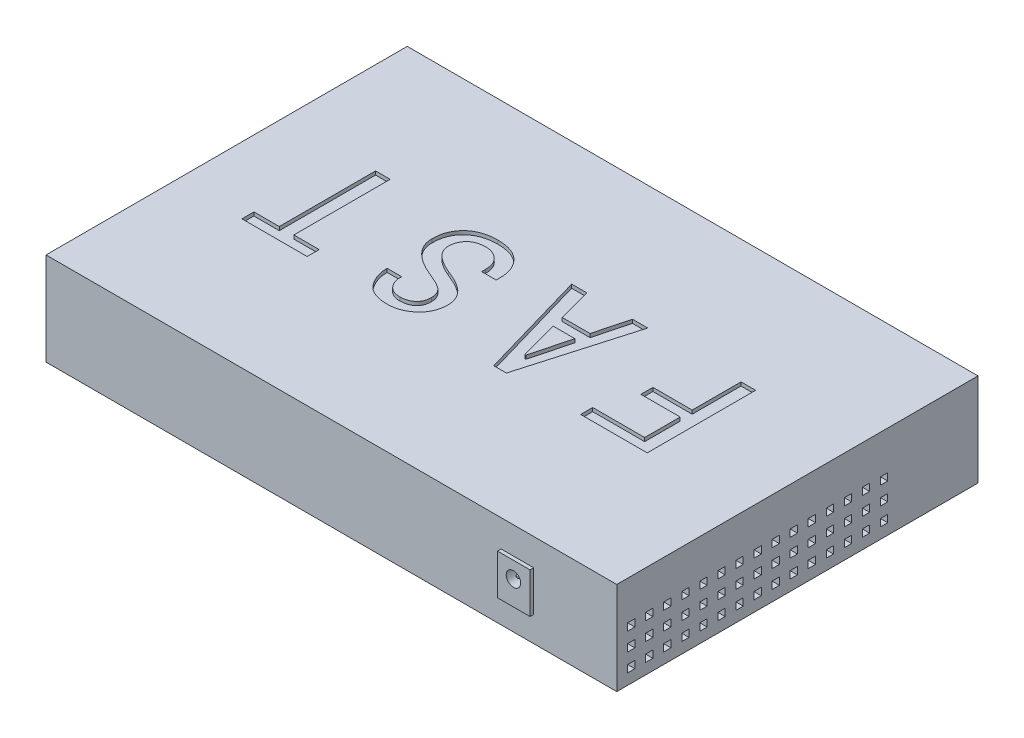
from build123d import *

# Parameters (mm, degrees)
SKETCH_1_W                     = 158
SKETCH_1_H                     = 100
EXTRUDE_1_DEPTH                = 25.7
CUT_EXTRUDE_1_DEPTH            = 11
PATTERN_LINEAR_1_COUNT         = 8
PATTERN_LINEAR_1_PITCH         = 14.7
SKETCH_3_W                     = 120
SKETCH_3_H                     = 15.5
SKETCH_3_W_2                   = 118
SKETCH_3_H_2                   = 13.5
CUT_EXTRUDE_2_DEPTH            = 13
CUT_EXTRUDE_3_DEPTH            = 1
SKETCH_5_R                     = 2
SKETCH_5_R_2                   = 0.5
CUT_EXTRUDE_4_DEPTH            = 8
FILLET_1_R                     = 0.4
EXTRUDE_START                  = 1
SKETCH_6_W                     = 9
SKETCH_6_H                     = 11.2
SKETCH_6_R                     = 2
EXTRUDE_2_DEPTH                = 1
SKETCH_7_W                     = 2
SKETCH_7_H                     = 2
CUT_EXTRUDE_5_DEPTH            = 10
PATTERN_LINEAR_2_COUNT         = 15
PATTERN_LINEAR_2_PITCH         = 5
PATTERN_LINEAR_2_COUNT_DIR2    = 3
PATTERN_LINEAR_2_PITCH_DIR2    = 5
MIRROR_1_COPY_1_SKETCH_W       = 2
MIRROR_1_COPY_1_SKETCH_H       = 2
MIRROR_1_COPY_1_DEPTH          = 10
MIRROR_1_COPY_2_SKETCH_W       = 2
MIRROR_1_COPY_2_SKETCH_H       = 2
MIRROR_1_COPY_2_DEPTH          = 10
MIRROR_1_COPY_3_SKETCH_W       = 2
MIRROR_1_COPY_3_SKETCH_H       = 2
MIRROR_1_COPY_3_DEPTH          = 10
MIRROR_1_COPY_4_SKETCH_W       = 2
MIRROR_1_COPY_4_SKETCH_H       = 2
MIRROR_1_COPY_4_DEPTH          = 10
MIRROR_1_COPY_5_SKETCH_W       = 2
MIRROR_1_COPY_5_SKETCH_H       = 2
MIRROR_1_COPY_5_DEPTH          = 10
MIRROR_1_COPY_6_SKETCH_W       = 2
MIRROR_1_COPY_6_SKETCH_H       = 2
MIRROR_1_COPY_6_DEPTH          = 10
MIRROR_1_COPY_7_SKETCH_W       = 2
MIRROR_1_COPY_7_SKETCH_H       = 2
MIRROR_1_COPY_7_DEPTH          = 10
MIRROR_1_COPY_8_SKETCH_W       = 2
MIRROR_1_COPY_8_SKETCH_H       = 2
MIRROR_1_COPY_8_DEPTH          = 10
MIRROR_1_COPY_9_SKETCH_W       = 2
MIRROR_1_COPY_9_SKETCH_H       = 2
MIRROR_1_COPY_9_DEPTH          = 10
MIRROR_1_COPY_10_SKETCH_W      = 2
MIRROR_1_COPY_10_SKETCH_H      = 2
MIRROR_1_COPY_10_DEPTH         = 10
MIRROR_1_COPY_11_SKETCH_W      = 2
MIRROR_1_COPY_11_SKETCH_H      = 2
MIRROR_1_COPY_11_DEPTH         = 10
MIRROR_1_COPY_12_SKETCH_W      = 2
MIRROR_1_COPY_12_SKETCH_H      = 2
MIRROR_1_COPY_12_DEPTH         = 10
MIRROR_1_COPY_13_SKETCH_W      = 2
MIRROR_1_COPY_13_SKETCH_H      = 2
MIRROR_1_COPY_13_DEPTH         = 10
MIRROR_1_COPY_14_SKETCH_W      = 2
MIRROR_1_COPY_14_SKETCH_H      = 2
MIRROR_1_COPY_14_DEPTH         = 10
MIRROR_1_COPY_15_SKETCH_W      = 2
MIRROR_1_COPY_15_SKETCH_H      = 2
MIRROR_1_COPY_15_DEPTH         = 10
MIRROR_1_COPY_16_SKETCH_W      = 2
MIRROR_1_COPY_16_SKETCH_H      = 2
MIRROR_1_COPY_16_DEPTH         = 10
MIRROR_1_COPY_17_SKETCH_W      = 2
MIRROR_1_COPY_17_SKETCH_H      = 2
MIRROR_1_COPY_17_DEPTH         = 10
MIRROR_1_COPY_18_SKETCH_W      = 2
MIRROR_1_COPY_18_SKETCH_H      = 2
MIRROR_1_COPY_18_DEPTH         = 10
MIRROR_1_COPY_19_SKETCH_W      = 2
MIRROR_1_COPY_19_SKETCH_H      = 2
MIRROR_1_COPY_19_DEPTH         = 10
MIRROR_1_COPY_20_SKETCH_W      = 2
MIRROR_1_COPY_20_SKETCH_H      = 2
MIRROR_1_COPY_20_DEPTH         = 10
MIRROR_1_COPY_21_SKETCH_W      = 2
MIRROR_1_COPY_21_SKETCH_H      = 2
MIRROR_1_COPY_21_DEPTH         = 10
MIRROR_1_COPY_22_SKETCH_W      = 2
MIRROR_1_COPY_22_SKETCH_H      = 2
MIRROR_1_COPY_22_DEPTH         = 10
MIRROR_1_COPY_23_SKETCH_W      = 2
MIRROR_1_COPY_23_SKETCH_H      = 2
MIRROR_1_COPY_23_DEPTH         = 10
MIRROR_1_COPY_24_SKETCH_W      = 2
MIRROR_1_COPY_24_SKETCH_H      = 2
MIRROR_1_COPY_24_DEPTH         = 10
MIRROR_1_COPY_25_SKETCH_W      = 2
MIRROR_1_COPY_25_SKETCH_H      = 2
MIRROR_1_COPY_25_DEPTH         = 10
MIRROR_1_COPY_26_SKETCH_W      = 2
MIRROR_1_COPY_26_SKETCH_H      = 2
MIRROR_1_COPY_26_DEPTH         = 10
MIRROR_1_COPY_27_SKETCH_W      = 2
MIRROR_1_COPY_27_SKETCH_H      = 2
MIRROR_1_COPY_27_DEPTH         = 10
MIRROR_1_COPY_28_SKETCH_W      = 2
MIRROR_1_COPY_28_SKETCH_H      = 2
MIRROR_1_COPY_28_DEPTH         = 10
MIRROR_1_COPY_29_SKETCH_W      = 2
MIRROR_1_COPY_29_SKETCH_H      = 2
MIRROR_1_COPY_29_DEPTH         = 10
MIRROR_1_COPY_30_SKETCH_W      = 2
MIRROR_1_COPY_30_SKETCH_H      = 2
MIRROR_1_COPY_30_DEPTH         = 10
MIRROR_1_COPY_31_SKETCH_W      = 2
MIRROR_1_COPY_31_SKETCH_H      = 2
MIRROR_1_COPY_31_DEPTH         = 10
MIRROR_1_COPY_32_SKETCH_W      = 2
MIRROR_1_COPY_32_SKETCH_H      = 2
MIRROR_1_COPY_32_DEPTH         = 10
MIRROR_1_COPY_33_SKETCH_W      = 2
MIRROR_1_COPY_33_SKETCH_H      = 2
MIRROR_1_COPY_33_DEPTH         = 10
MIRROR_1_COPY_34_SKETCH_W      = 2
MIRROR_1_COPY_34_SKETCH_H      = 2
MIRROR_1_COPY_34_DEPTH         = 10
MIRROR_1_COPY_35_SKETCH_W      = 2
MIRROR_1_COPY_35_SKETCH_H      = 2
MIRROR_1_COPY_35_DEPTH         = 10
MIRROR_1_COPY_36_SKETCH_W      = 2
MIRROR_1_COPY_36_SKETCH_H      = 2
MIRROR_1_COPY_36_DEPTH         = 10
MIRROR_1_COPY_37_SKETCH_W      = 2
MIRROR_1_COPY_37_SKETCH_H      = 2
MIRROR_1_COPY_37_DEPTH         = 10
MIRROR_1_COPY_38_SKETCH_W      = 2
MIRROR_1_COPY_38_SKETCH_H      = 2
MIRROR_1_COPY_38_DEPTH         = 10
MIRROR_1_COPY_39_SKETCH_W      = 2
MIRROR_1_COPY_39_SKETCH_H      = 2
MIRROR_1_COPY_39_DEPTH         = 10
MIRROR_1_COPY_40_SKETCH_W      = 2
MIRROR_1_COPY_40_SKETCH_H      = 2
MIRROR_1_COPY_40_DEPTH         = 10
MIRROR_1_COPY_41_SKETCH_W      = 2
MIRROR_1_COPY_41_SKETCH_H      = 2
MIRROR_1_COPY_41_DEPTH         = 10
MIRROR_1_COPY_42_SKETCH_W      = 2
MIRROR_1_COPY_42_SKETCH_H      = 2
MIRROR_1_COPY_42_DEPTH         = 10
MIRROR_1_COPY_43_SKETCH_W      = 2
MIRROR_1_COPY_43_SKETCH_H      = 2
MIRROR_1_COPY_43_DEPTH         = 10
MIRROR_1_COPY_44_SKETCH_W      = 2
MIRROR_1_COPY_44_SKETCH_H      = 2
MIRROR_1_COPY_44_DEPTH         = 10
SKETCH_8_W                     = 6
SKETCH_8_H                     = 4
CUT_EXTRUDE_6_DEPTH            = 5
SKETCH_9_W                     = 2
SKETCH_9_H                     = 3
EXTRUDE_3_DEPTH                = 5
SKETCH_10_R                    = 1.1
SKETCH_10_R_2                  = 1
CUT_EXTRUDE_7_DEPTH            = 1
FILLET_2_R                     = 1
PATTERN_LINEAR_4_COUNT         = 2
PATTERN_LINEAR_4_PITCH         = 5
FILLET_2_OF_PATTERN_LINEAR_4_R = 1


with BuildPart() as part:
    # 草图1 → 凸台-拉伸1 (new body)
    with BuildSketch(Plane(origin=(0, 0, 0), x_dir=(1, 0, 0), z_dir=(0, 1, 0))):
        Rectangle(SKETCH_1_W, SKETCH_1_H)
    extrude(amount=EXTRUDE_1_DEPTH)

    # 草图2 → 切除-拉伸1 (cut)
    with BuildSketch(Plane(origin=(0, 0, -50), x_dir=(-1, 0, 0), z_dir=(0, 0, -1))):
        Polygon((-44.7, 9.4), (-56.7, 9.4), (-56.7, 16.4), (-53.8, 16.4), (-53.8, 17.9), (-52.75, 17.9), (-52.75, 19.4), (-48.65, 19.4), (-48.65, 17.9), (-47.6, 17.9), (-47.6, 16.4), (-44.7, 16.4), align=None)
    cut_extrude_1 = extrude(amount=-CUT_EXTRUDE_1_DEPTH, mode=Mode.SUBTRACT)

    # 阵列(线性)1: 切除-拉伸1 ×8
    with Locations(*[(-i * PATTERN_LINEAR_1_PITCH, 0, 0) for i in range(1, PATTERN_LINEAR_1_COUNT)]):
        add(cut_extrude_1, mode=Mode.SUBTRACT)

    # 草图3 → 切除-拉伸2 (cut)
    with BuildSketch(Plane(origin=(0, 0, -50), x_dir=(-1, 0, 0), z_dir=(0, 0, -1))):
        with Locations((0, 13.95)):
            Rectangle(SKETCH_3_W, SKETCH_3_H)
        with Locations((0, 13.95)):
            Rectangle(SKETCH_3_W_2, SKETCH_3_H_2, mode=Mode.SUBTRACT)
    extrude(amount=-CUT_EXTRUDE_2_DEPTH, mode=Mode.SUBTRACT)

    # 草图4 → 切除-拉伸3 (cut)
    # profile 1 of 4: a face of its own
    with BuildSketch(Plane(origin=(0, 25.7, 0), x_dir=(1, 0, 0), z_dir=(0, 1, 0))):
        Polygon((-60.538684768, -10.903965786), (-53.521140909, -10.903965786), (-53.521140909, 15.762700881), (-49.486053189, 15.762700881), (-49.486053189, -10.903965786), (-42.46850933, -10.903965786), (-42.46850933, -14.237299119), (-60.538684768, -14.237299119), align=None)
    # profile 2 of 4: a face of its own
    with BuildSketch(Plane(origin=(0, 25.7, 0), x_dir=(1, 0, 0), z_dir=(0, 1, 0))):
        with BuildLine():
            add(Edge.make_bspline(
                [(-29.45096547, 7.341648249), (-29.443750655, 7.669045713), (-29.42965478, 8.308695296), (-29.311429656, 9.244722705), (-29.111451558, 10.128478376), (-28.830816099, 10.960497752), (-28.472227092, 11.738767941), (-28.033945629, 12.464173796), (-27.517874369, 13.140150689), (-26.917249359, 13.753008988), (-26.257211854, 14.316321199), (-25.526009929, 14.796102086), (-24.73764707, 15.199832312), (-23.897873054, 15.540946388), (-22.998003641, 15.799123872), (-22.04075881, 15.979228981), (-21.028223701, 16.090977755), (-20.332784428, 16.105933045), (-19.97728126, 16.113578074)],
                knots=[0, 0, 0, 0, 1.076152623, 2.102522632, 3.095849728, 4.050677474, 4.984236423, 5.907526567, 6.831914559, 7.773667167, 8.723756284, 9.679698709, 10.641564268, 11.632028302, 12.655206477, 13.713851791, 14.831338746, 16, 16, 16, 16], degree=3))
            add(Edge.make_bspline(
                [(-19.97728126, 16.113578074), (-19.621718476, 16.106603863), (-18.928073296, 16.092998313), (-17.919951909, 15.972609753), (-16.969304367, 15.785827901), (-16.076350171, 15.52331859), (-15.247992653, 15.169827998), (-14.481742913, 14.74195787), (-13.765120761, 14.251516669), (-13.129672402, 13.66743873), (-12.54700089, 13.043319187), (-12.055454937, 12.361129396), (-11.628781235, 11.649352281), (-11.27408703, 10.900615469), (-11.007908336, 10.10818018), (-10.82216562, 9.278250188), (-10.699904752, 8.410885227), (-10.686074938, 7.818571185), (-10.679035646, 7.517086845)],
                knots=[0, 0, 0, 0, 1.196431777, 2.334043873, 3.412092395, 4.454650557, 5.460757451, 6.436532977, 7.405283824, 8.375816144, 9.335554645, 10.274635542, 11.199860808, 12.126090833, 13.057499603, 14.007217359, 14.985685436, 16, 16, 16, 16], degree=3))
            Line((-10.679035646, 7.517086845), (-10.679035646, 6.28901667))
            Line((-10.679035646, 6.28901667), (-14.714123365, 6.28901667))
            Line((-14.714123365, 6.28901667), (-14.714123365, 7.341648249))
            add(Edge.make_bspline(
                [(-14.714123365, 7.341648249), (-14.719553908, 7.554082), (-14.730169531, 7.969347427), (-14.799750403, 8.572448076), (-14.924024286, 9.138491055), (-15.098297559, 9.663390597), (-15.321351935, 10.152419065), (-15.595397418, 10.60051656), (-15.914937209, 11.015652353), (-16.408439808, 11.501151711), (-17.088899768, 12.013502745), (-17.992938732, 12.456724468), (-18.962081614, 12.737602055), (-19.635316612, 12.765880776), (-19.97728126, 12.78024474)],
                knots=[0, 0, 0, 0, 0.89970853, 1.758749939, 2.566656616, 3.349866332, 4.096893782, 4.837870496, 5.569993442, 6.309435511, 7.764284211, 9.154994143, 10.554900695, 12, 12, 12, 12], degree=3))
            add(Edge.make_bspline(
                [(-19.97728126, 12.78024474), (-20.202635285, 12.774191525), (-20.641287115, 12.762408935), (-21.277028152, 12.702173773), (-21.865789736, 12.582924397), (-22.410140801, 12.42384673), (-22.903175594, 12.207795572), (-23.354405499, 11.952011975), (-23.75841661, 11.647939641), (-24.219578503, 11.179100003), (-24.700369691, 10.524849709), (-25.112201041, 9.64840775), (-25.369829881, 8.694619921), (-25.400275595, 8.032059804), (-25.415877751, 7.692525442)],
                knots=[0, 0, 0, 0, 0.962256228, 1.873032692, 2.721618148, 3.523059968, 4.28910919, 5.013874417, 5.733193765, 6.439259544, 7.815088487, 9.175735836, 10.552682683, 12, 12, 12, 12], degree=3))
            add(Edge.make_bspline(
                [(-25.415877751, 7.692525442), (-25.410508486, 7.547109527), (-25.399865558, 7.258866912), (-25.325208071, 6.829243729), (-25.203614467, 6.407388039), (-25.022849797, 5.996272761), (-24.804340071, 5.59016833), (-24.52344785, 5.20051806), (-24.208752335, 4.808088534), (-23.696419923, 4.295233848), (-22.939877411, 3.67401439), (-21.878166781, 2.981843958), (-20.645210805, 2.317779786), (-19.746689303, 1.93062667), (-19.275526874, 1.727613161)],
                knots=[0, 0, 0, 0, 0.578138014, 1.145981947, 1.729294273, 2.319686506, 2.928759201, 3.559612696, 4.226874004, 4.927334085, 6.438251822, 8.110552943, 9.960470262, 12, 12, 12, 12], degree=3))
            add(Edge.make_bspline(
                [(-19.275526874, 1.727613161), (-18.936814324, 1.595403281), (-18.279110594, 1.338681375), (-17.334593564, 0.930443959), (-16.466362537, 0.50801221), (-15.667060465, 0.083779253), (-14.952963359, -0.37085276), (-14.299936359, -0.819514414), (-13.727181499, -1.287865282), (-13.225967469, -1.768645738), (-12.787214229, -2.261300416), (-12.414052589, -2.78148048), (-12.094332831, -3.31977139), (-11.833410379, -3.881405678), (-11.62869673, -4.464348155), (-11.490163816, -5.070606257), (-11.391304547, -5.698233022), (-11.384331012, -6.125571061), (-11.380790031, -6.342562277)],
                knots=[0, 0, 0, 0, 1.44289125, 2.801770879, 4.081899673, 5.274145028, 6.390249298, 7.439444364, 8.416746341, 9.322525631, 10.193374079, 11.030703231, 11.859162121, 12.674406529, 13.484468958, 14.305897585, 15.139778559, 16, 16, 16, 16], degree=3))
            add(Edge.make_bspline(
                [(-11.380790031, -6.342562277), (-11.388171875, -6.641812434), (-11.402673232, -7.229678265), (-11.519893054, -8.090495027), (-11.722377493, -8.906667038), (-12.001882492, -9.678609271), (-12.363564018, -10.405198997), (-12.799164135, -11.09264481), (-13.323642739, -11.730728457), (-13.919103953, -12.317110621), (-14.567521494, -12.846509933), (-15.247214535, -13.316605838), (-15.96169019, -13.709913393), (-16.707304728, -14.027369527), (-17.479626464, -14.285210566), (-18.286501464, -14.455515638), (-19.120388423, -14.57404352), (-19.688781821, -14.583418071), (-19.97728126, -14.588176312)],
                knots=[0, 0, 0, 0, 1.0788326, 2.119326615, 3.125182374, 4.106076261, 5.07360188, 6.046409066, 7.034459578, 8.045125104, 9.055156691, 10.049515184, 11.021287185, 11.990419179, 12.968479412, 13.952012744, 14.960503105, 16, 16, 16, 16], degree=3))
            add(Edge.make_bspline(
                [(-19.97728126, -14.588176312), (-20.343637061, -14.578702484), (-21.054675075, -14.560315297), (-22.082594413, -14.44021205), (-23.030731254, -14.227651477), (-23.896113118, -13.92435536), (-24.690646464, -13.552993203), (-25.398375086, -13.077747077), (-26.029689901, -12.521991125), (-26.570823095, -11.881368794), (-27.037221157, -11.194922922), (-27.449733166, -10.49237444), (-27.795899231, -9.775483959), (-28.07560186, -9.044316251), (-28.296640369, -8.30138382), (-28.463854366, -7.544446921), (-28.552666716, -6.771389818), (-28.566731692, -6.251791262), (-28.573772488, -5.991685084)],
                knots=[0, 0, 0, 0, 1.28175531, 2.487682045, 3.614567697, 4.673842096, 5.690659004, 6.674263201, 7.645914222, 8.624015204, 9.599323496, 10.546797625, 11.472071828, 12.381193182, 13.282671128, 14.181884892, 15.08986858, 16, 16, 16, 16], degree=3))
            Line((-28.573772488, -5.991685084), (-24.538684768, -5.991685084))
            add(Edge.make_bspline(
                [(-24.538684768, -5.991685084), (-24.551630151, -6.306441302), (-24.577129563, -6.926438329), (-24.389436124, -7.843814389), (-24.032444247, -8.714031067), (-23.595706449, -9.385099964), (-23.172240568, -9.87513577), (-22.809831494, -10.195355158), (-22.419517414, -10.471800666), (-21.991688109, -10.692210394), (-21.535104635, -10.870007509), (-21.043947631, -10.992524151), (-20.520857683, -11.063745017), (-20.161608082, -11.07409429), (-19.97728126, -11.079404383)],
                knots=[0, 0, 0, 0, 1.460337498, 2.876527481, 4.312878904, 5.812994545, 6.576621744, 7.318487167, 8.056101962, 8.794884686, 9.550500188, 10.329708525, 11.142992725, 12, 12, 12, 12], degree=3))
            add(Edge.make_bspline(
                [(-19.97728126, -11.079404383), (-19.642301548, -11.067582259), (-19.003684974, -11.045044166), (-18.102120892, -10.823047583), (-17.302347397, -10.474759146), (-16.626605667, -9.96606489), (-16.081961041, -9.339721242), (-15.687600187, -8.603547081), (-15.457579135, -7.766163438), (-15.430138965, -7.175735482), (-15.415877751, -6.868878067)],
                knots=[0, 0, 0, 0, 1.145196218, 2.183240533, 3.159303635, 4.113187715, 5.054501613, 5.980375362, 6.950360008, 8, 8, 8, 8], degree=3))
            add(Edge.make_bspline(
                [(-15.415877751, -6.868878067), (-15.426137073, -6.614370155), (-15.44623547, -6.115779591), (-15.633407962, -5.396235061), (-15.946635317, -4.736749183), (-16.302769315, -4.225138345), (-16.683781069, -3.832626561), (-17.078703742, -3.534227698), (-17.563094347, -3.217765096), (-18.135452896, -2.875239973), (-18.814784441, -2.540131873), (-19.579546282, -2.171003093), (-20.44821718, -1.805287371), (-21.059885265, -1.559323663), (-21.380790031, -1.430281576)],
                knots=[0, 0, 0, 0, 1.054883135, 2.066555707, 3.059848824, 4.072479495, 4.638249345, 5.32340314, 6.121246806, 7.040116569, 8.089430973, 9.263589922, 10.564373294, 12, 12, 12, 12], degree=3))
            add(Edge.make_bspline(
                [(-21.380790031, -1.430281576), (-21.69388835, -1.298679095), (-22.308012328, -1.040548553), (-23.191086916, -0.615176557), (-24.025305729, -0.180932569), (-24.789573782, 0.297059952), (-25.517483961, 0.763121512), (-26.179462455, 1.268162138), (-26.792301171, 1.785272693), (-27.346229198, 2.325849731), (-27.841891676, 2.884016551), (-28.274831748, 3.461857354), (-28.631692587, 4.066010033), (-28.934798441, 4.680546426), (-29.161969267, 5.320535411), (-29.333098884, 5.974030795), (-29.432676304, 6.651998711), (-29.444811047, 7.10957669), (-29.45096547, 7.341648249)],
                knots=[0, 0, 0, 0, 1.286068061, 2.522547032, 3.711501896, 4.845417235, 5.935213634, 6.983562898, 7.996094287, 8.970630699, 9.912084199, 10.820990558, 11.700244104, 12.56607903, 13.411983543, 14.267498443, 15.121320617, 16, 16, 16, 16], degree=3))
        make_face()
    # profile 3 of 4: a face of its own
    with BuildSketch(Plane(origin=(0, 25.7, 0), x_dir=(1, 0, 0), z_dir=(0, 1, 0))):
        Polygon((0.759560846, 15.762700881), (4.970087161, 15.762700881), (7.426227512, 6.464455266), (15.145525758, 6.464455266), (17.601666109, 15.762700881), (21.812192425, 15.762700881), (13.0402626, -14.588176312), (9.53149067, -14.588176312), align=None)
        Polygon((8.303420495, 3.131121933), (11.110438039, -7.570632453), (11.461315232, -7.570632453), (14.268332776, 3.131121933), align=None, mode=Mode.SUBTRACT)
    # profile 4 of 4: a face of its own
    with BuildSketch(Plane(origin=(0, 25.7, 0), x_dir=(1, 0, 0), z_dir=(0, 1, 0))):
        Polygon((33.250788916, -10.903965786), (47.636753828, -10.903965786), (47.636753828, -1.079404383), (36.759560846, -1.079404383), (36.759560846, 2.253928951), (47.636753828, 2.253928951), (47.636753828, 15.762700881), (51.671841547, 15.762700881), (51.671841547, -14.237299119), (33.250788916, -14.237299119), align=None)
    extrude(amount=-CUT_EXTRUDE_3_DEPTH, mode=Mode.SUBTRACT)

    # 草图5 → 切除-拉伸4 (cut)
    with BuildSketch(Plane.XY.offset(50)):
        with Locations((51.4, 13.7)):
            Circle(SKETCH_5_R)
        with Locations((51.4, 13.7)):
            Circle(SKETCH_5_R_2, mode=Mode.SUBTRACT)
    extrude(amount=-CUT_EXTRUDE_4_DEPTH, mode=Mode.SUBTRACT)

    # 圆角1
    fillet_1_edges = [part.edges().sort_by_distance(p)[0] for p in [
        (50.9, 13.7, 50),
    ]]
    fillet(fillet_1_edges, radius=FILLET_1_R)

    # 草图6 → 凸台-拉伸2 (add)
    with BuildSketch(Plane.XY.offset(50).offset(EXTRUDE_START)):
        with Locations((51.5, 12.6)):
            Rectangle(SKETCH_6_W, SKETCH_6_H)
        with Locations((51.4, 13.7)):
            Circle(SKETCH_6_R, mode=Mode.SUBTRACT)
    extrude(amount=-EXTRUDE_2_DEPTH)

    # 草图7 → 切除-拉伸5 (cut)
    with BuildSketch(Plane(origin=(79, 0, 0), x_dir=(0, 0, -1), z_dir=(1, 0, 0))):
        with Locations((-46, 14)):
            Rectangle(SKETCH_7_W, SKETCH_7_H)
    cut_extrude_5 = extrude(amount=-CUT_EXTRUDE_5_DEPTH, mode=Mode.SUBTRACT)

    # 阵列(线性)2: Cut-Extrude 5 15 × 3
    with Locations(*[(0, -j * PATTERN_LINEAR_2_PITCH_DIR2, -i * PATTERN_LINEAR_2_PITCH) for i in range(PATTERN_LINEAR_2_COUNT) for j in range(PATTERN_LINEAR_2_COUNT_DIR2) if (i, j) != (0, 0)]):
        add(cut_extrude_5, mode=Mode.SUBTRACT)

    # 镜向1: 切除-拉伸5 across plane
    add(cut_extrude_5.mirror(Plane(origin=(0, 0, 0), x_dir=(0, 0, 1), z_dir=(1, 0, 0))), mode=Mode.SUBTRACT)

    # 镜向1 copy 1 sketch → 镜向1 copy 1 (cut)
    with BuildSketch(Plane(origin=(-79, -5, 0), x_dir=(0, 0, -1), z_dir=(-1, 0, 0))):
        with Locations((-46, -14)):
            Rectangle(MIRROR_1_COPY_1_SKETCH_W, MIRROR_1_COPY_1_SKETCH_H)
    extrude(amount=-MIRROR_1_COPY_1_DEPTH, mode=Mode.SUBTRACT)

    # 镜向1 copy 2 sketch → 镜向1 copy 2 (cut)
    with BuildSketch(Plane(origin=(-79, -10, 0), x_dir=(0, 0, -1), z_dir=(-1, 0, 0))):
        with Locations((-46, -14)):
            Rectangle(MIRROR_1_COPY_2_SKETCH_W, MIRROR_1_COPY_2_SKETCH_H)
    extrude(amount=-MIRROR_1_COPY_2_DEPTH, mode=Mode.SUBTRACT)

    # 镜向1 copy 3 sketch → 镜向1 copy 3 (cut)
    with BuildSketch(Plane(origin=(-79, 0, -5), x_dir=(0, 0, -1), z_dir=(-1, 0, 0))):
        with Locations((-46, -14)):
            Rectangle(MIRROR_1_COPY_3_SKETCH_W, MIRROR_1_COPY_3_SKETCH_H)
    extrude(amount=-MIRROR_1_COPY_3_DEPTH, mode=Mode.SUBTRACT)

    # 镜向1 copy 4 sketch → 镜向1 copy 4 (cut)
    with BuildSketch(Plane(origin=(-79, -5, -5), x_dir=(0, 0, -1), z_dir=(-1, 0, 0))):
        with Locations((-46, -14)):
            Rectangle(MIRROR_1_COPY_4_SKETCH_W, MIRROR_1_COPY_4_SKETCH_H)
    extrude(amount=-MIRROR_1_COPY_4_DEPTH, mode=Mode.SUBTRACT)

    # 镜向1 copy 5 sketch → 镜向1 copy 5 (cut)
    with BuildSketch(Plane(origin=(-79, -10, -5), x_dir=(0, 0, -1), z_dir=(-1, 0, 0))):
        with Locations((-46, -14)):
            Rectangle(MIRROR_1_COPY_5_SKETCH_W, MIRROR_1_COPY_5_SKETCH_H)
    extrude(amount=-MIRROR_1_COPY_5_DEPTH, mode=Mode.SUBTRACT)

    # 镜向1 copy 6 sketch → 镜向1 copy 6 (cut)
    with BuildSketch(Plane(origin=(-79, 0, -10), x_dir=(0, 0, -1), z_dir=(-1, 0, 0))):
        with Locations((-46, -14)):
            Rectangle(MIRROR_1_COPY_6_SKETCH_W, MIRROR_1_COPY_6_SKETCH_H)
    extrude(amount=-MIRROR_1_COPY_6_DEPTH, mode=Mode.SUBTRACT)

    # 镜向1 copy 7 sketch → 镜向1 copy 7 (cut)
    with BuildSketch(Plane(origin=(-79, -5, -10), x_dir=(0, 0, -1), z_dir=(-1, 0, 0))):
        with Locations((-46, -14)):
            Rectangle(MIRROR_1_COPY_7_SKETCH_W, MIRROR_1_COPY_7_SKETCH_H)
    extrude(amount=-MIRROR_1_COPY_7_DEPTH, mode=Mode.SUBTRACT)

    # 镜向1 copy 8 sketch → 镜向1 copy 8 (cut)
    with BuildSketch(Plane(origin=(-79, -10, -10), x_dir=(0, 0, -1), z_dir=(-1, 0, 0))):
        with Locations((-46, -14)):
            Rectangle(MIRROR_1_COPY_8_SKETCH_W, MIRROR_1_COPY_8_SKETCH_H)
    extrude(amount=-MIRROR_1_COPY_8_DEPTH, mode=Mode.SUBTRACT)

    # 镜向1 copy 9 sketch → 镜向1 copy 9 (cut)
    with BuildSketch(Plane(origin=(-79, 0, -15), x_dir=(0, 0, -1), z_dir=(-1, 0, 0))):
        with Locations((-46, -14)):
            Rectangle(MIRROR_1_COPY_9_SKETCH_W, MIRROR_1_COPY_9_SKETCH_H)
    extrude(amount=-MIRROR_1_COPY_9_DEPTH, mode=Mode.SUBTRACT)

    # 镜向1 copy 10 sketch → 镜向1 copy 10 (cut)
    with BuildSketch(Plane(origin=(-79, -5, -15), x_dir=(0, 0, -1), z_dir=(-1, 0, 0))):
        with Locations((-46, -14)):
            Rectangle(MIRROR_1_COPY_10_SKETCH_W, MIRROR_1_COPY_10_SKETCH_H)
    extrude(amount=-MIRROR_1_COPY_10_DEPTH, mode=Mode.SUBTRACT)

    # 镜向1 copy 11 sketch → 镜向1 copy 11 (cut)
    with BuildSketch(Plane(origin=(-79, -10, -15), x_dir=(0, 0, -1), z_dir=(-1, 0, 0))):
        with Locations((-46, -14)):
            Rectangle(MIRROR_1_COPY_11_SKETCH_W, MIRROR_1_COPY_11_SKETCH_H)
    extrude(amount=-MIRROR_1_COPY_11_DEPTH, mode=Mode.SUBTRACT)

    # 镜向1 copy 12 sketch → 镜向1 copy 12 (cut)
    with BuildSketch(Plane(origin=(-79, 0, -20), x_dir=(0, 0, -1), z_dir=(-1, 0, 0))):
        with Locations((-46, -14)):
            Rectangle(MIRROR_1_COPY_12_SKETCH_W, MIRROR_1_COPY_12_SKETCH_H)
    extrude(amount=-MIRROR_1_COPY_12_DEPTH, mode=Mode.SUBTRACT)

    # 镜向1 copy 13 sketch → 镜向1 copy 13 (cut)
    with BuildSketch(Plane(origin=(-79, -5, -20), x_dir=(0, 0, -1), z_dir=(-1, 0, 0))):
        with Locations((-46, -14)):
            Rectangle(MIRROR_1_COPY_13_SKETCH_W, MIRROR_1_COPY_13_SKETCH_H)
    extrude(amount=-MIRROR_1_COPY_13_DEPTH, mode=Mode.SUBTRACT)

    # 镜向1 copy 14 sketch → 镜向1 copy 14 (cut)
    with BuildSketch(Plane(origin=(-79, -10, -20), x_dir=(0, 0, -1), z_dir=(-1, 0, 0))):
        with Locations((-46, -14)):
            Rectangle(MIRROR_1_COPY_14_SKETCH_W, MIRROR_1_COPY_14_SKETCH_H)
    extrude(amount=-MIRROR_1_COPY_14_DEPTH, mode=Mode.SUBTRACT)

    # 镜向1 copy 15 sketch → 镜向1 copy 15 (cut)
    with BuildSketch(Plane(origin=(-79, 0, -25), x_dir=(0, 0, -1), z_dir=(-1, 0, 0))):
        with Locations((-46, -14)):
            Rectangle(MIRROR_1_COPY_15_SKETCH_W, MIRROR_1_COPY_15_SKETCH_H)
    extrude(amount=-MIRROR_1_COPY_15_DEPTH, mode=Mode.SUBTRACT)

    # 镜向1 copy 16 sketch → 镜向1 copy 16 (cut)
    with BuildSketch(Plane(origin=(-79, -5, -25), x_dir=(0, 0, -1), z_dir=(-1, 0, 0))):
        with Locations((-46, -14)):
            Rectangle(MIRROR_1_COPY_16_SKETCH_W, MIRROR_1_COPY_16_SKETCH_H)
    extrude(amount=-MIRROR_1_COPY_16_DEPTH, mode=Mode.SUBTRACT)

    # 镜向1 copy 17 sketch → 镜向1 copy 17 (cut)
    with BuildSketch(Plane(origin=(-79, -10, -25), x_dir=(0, 0, -1), z_dir=(-1, 0, 0))):
        with Locations((-46, -14)):
            Rectangle(MIRROR_1_COPY_17_SKETCH_W, MIRROR_1_COPY_17_SKETCH_H)
    extrude(amount=-MIRROR_1_COPY_17_DEPTH, mode=Mode.SUBTRACT)

    # 镜向1 copy 18 sketch → 镜向1 copy 18 (cut)
    with BuildSketch(Plane(origin=(-79, 0, -30), x_dir=(0, 0, -1), z_dir=(-1, 0, 0))):
        with Locations((-46, -14)):
            Rectangle(MIRROR_1_COPY_18_SKETCH_W, MIRROR_1_COPY_18_SKETCH_H)
    extrude(amount=-MIRROR_1_COPY_18_DEPTH, mode=Mode.SUBTRACT)

    # 镜向1 copy 19 sketch → 镜向1 copy 19 (cut)
    with BuildSketch(Plane(origin=(-79, -5, -30), x_dir=(0, 0, -1), z_dir=(-1, 0, 0))):
        with Locations((-46, -14)):
            Rectangle(MIRROR_1_COPY_19_SKETCH_W, MIRROR_1_COPY_19_SKETCH_H)
    extrude(amount=-MIRROR_1_COPY_19_DEPTH, mode=Mode.SUBTRACT)

    # 镜向1 copy 20 sketch → 镜向1 copy 20 (cut)
    with BuildSketch(Plane(origin=(-79, -10, -30), x_dir=(0, 0, -1), z_dir=(-1, 0, 0))):
        with Locations((-46, -14)):
            Rectangle(MIRROR_1_COPY_20_SKETCH_W, MIRROR_1_COPY_20_SKETCH_H)
    extrude(amount=-MIRROR_1_COPY_20_DEPTH, mode=Mode.SUBTRACT)

    # 镜向1 copy 21 sketch → 镜向1 copy 21 (cut)
    with BuildSketch(Plane(origin=(-79, 0, -35), x_dir=(0, 0, -1), z_dir=(-1, 0, 0))):
        with Locations((-46, -14)):
            Rectangle(MIRROR_1_COPY_21_SKETCH_W, MIRROR_1_COPY_21_SKETCH_H)
    extrude(amount=-MIRROR_1_COPY_21_DEPTH, mode=Mode.SUBTRACT)

    # 镜向1 copy 22 sketch → 镜向1 copy 22 (cut)
    with BuildSketch(Plane(origin=(-79, -5, -35), x_dir=(0, 0, -1), z_dir=(-1, 0, 0))):
        with Locations((-46, -14)):
            Rectangle(MIRROR_1_COPY_22_SKETCH_W, MIRROR_1_COPY_22_SKETCH_H)
    extrude(amount=-MIRROR_1_COPY_22_DEPTH, mode=Mode.SUBTRACT)

    # 镜向1 copy 23 sketch → 镜向1 copy 23 (cut)
    with BuildSketch(Plane(origin=(-79, -10, -35), x_dir=(0, 0, -1), z_dir=(-1, 0, 0))):
        with Locations((-46, -14)):
            Rectangle(MIRROR_1_COPY_23_SKETCH_W, MIRROR_1_COPY_23_SKETCH_H)
    extrude(amount=-MIRROR_1_COPY_23_DEPTH, mode=Mode.SUBTRACT)

    # 镜向1 copy 24 sketch → 镜向1 copy 24 (cut)
    with BuildSketch(Plane(origin=(-79, 0, -40), x_dir=(0, 0, -1), z_dir=(-1, 0, 0))):
        with Locations((-46, -14)):
            Rectangle(MIRROR_1_COPY_24_SKETCH_W, MIRROR_1_COPY_24_SKETCH_H)
    extrude(amount=-MIRROR_1_COPY_24_DEPTH, mode=Mode.SUBTRACT)

    # 镜向1 copy 25 sketch → 镜向1 copy 25 (cut)
    with BuildSketch(Plane(origin=(-79, -5, -40), x_dir=(0, 0, -1), z_dir=(-1, 0, 0))):
        with Locations((-46, -14)):
            Rectangle(MIRROR_1_COPY_25_SKETCH_W, MIRROR_1_COPY_25_SKETCH_H)
    extrude(amount=-MIRROR_1_COPY_25_DEPTH, mode=Mode.SUBTRACT)

    # 镜向1 copy 26 sketch → 镜向1 copy 26 (cut)
    with BuildSketch(Plane(origin=(-79, -10, -40), x_dir=(0, 0, -1), z_dir=(-1, 0, 0))):
        with Locations((-46, -14)):
            Rectangle(MIRROR_1_COPY_26_SKETCH_W, MIRROR_1_COPY_26_SKETCH_H)
    extrude(amount=-MIRROR_1_COPY_26_DEPTH, mode=Mode.SUBTRACT)

    # 镜向1 copy 27 sketch → 镜向1 copy 27 (cut)
    with BuildSketch(Plane(origin=(-79, 0, -45), x_dir=(0, 0, -1), z_dir=(-1, 0, 0))):
        with Locations((-46, -14)):
            Rectangle(MIRROR_1_COPY_27_SKETCH_W, MIRROR_1_COPY_27_SKETCH_H)
    extrude(amount=-MIRROR_1_COPY_27_DEPTH, mode=Mode.SUBTRACT)

    # 镜向1 copy 28 sketch → 镜向1 copy 28 (cut)
    with BuildSketch(Plane(origin=(-79, -5, -45), x_dir=(0, 0, -1), z_dir=(-1, 0, 0))):
        with Locations((-46, -14)):
            Rectangle(MIRROR_1_COPY_28_SKETCH_W, MIRROR_1_COPY_28_SKETCH_H)
    extrude(amount=-MIRROR_1_COPY_28_DEPTH, mode=Mode.SUBTRACT)

    # 镜向1 copy 29 sketch → 镜向1 copy 29 (cut)
    with BuildSketch(Plane(origin=(-79, -10, -45), x_dir=(0, 0, -1), z_dir=(-1, 0, 0))):
        with Locations((-46, -14)):
            Rectangle(MIRROR_1_COPY_29_SKETCH_W, MIRROR_1_COPY_29_SKETCH_H)
    extrude(amount=-MIRROR_1_COPY_29_DEPTH, mode=Mode.SUBTRACT)

    # 镜向1 copy 30 sketch → 镜向1 copy 30 (cut)
    with BuildSketch(Plane(origin=(-79, 0, -50), x_dir=(0, 0, -1), z_dir=(-1, 0, 0))):
        with Locations((-46, -14)):
            Rectangle(MIRROR_1_COPY_30_SKETCH_W, MIRROR_1_COPY_30_SKETCH_H)
    extrude(amount=-MIRROR_1_COPY_30_DEPTH, mode=Mode.SUBTRACT)

    # 镜向1 copy 31 sketch → 镜向1 copy 31 (cut)
    with BuildSketch(Plane(origin=(-79, -5, -50), x_dir=(0, 0, -1), z_dir=(-1, 0, 0))):
        with Locations((-46, -14)):
            Rectangle(MIRROR_1_COPY_31_SKETCH_W, MIRROR_1_COPY_31_SKETCH_H)
    extrude(amount=-MIRROR_1_COPY_31_DEPTH, mode=Mode.SUBTRACT)

    # 镜向1 copy 32 sketch → 镜向1 copy 32 (cut)
    with BuildSketch(Plane(origin=(-79, -10, -50), x_dir=(0, 0, -1), z_dir=(-1, 0, 0))):
        with Locations((-46, -14)):
            Rectangle(MIRROR_1_COPY_32_SKETCH_W, MIRROR_1_COPY_32_SKETCH_H)
    extrude(amount=-MIRROR_1_COPY_32_DEPTH, mode=Mode.SUBTRACT)

    # 镜向1 copy 33 sketch → 镜向1 copy 33 (cut)
    with BuildSketch(Plane(origin=(-79, 0, -55), x_dir=(0, 0, -1), z_dir=(-1, 0, 0))):
        with Locations((-46, -14)):
            Rectangle(MIRROR_1_COPY_33_SKETCH_W, MIRROR_1_COPY_33_SKETCH_H)
    extrude(amount=-MIRROR_1_COPY_33_DEPTH, mode=Mode.SUBTRACT)

    # 镜向1 copy 34 sketch → 镜向1 copy 34 (cut)
    with BuildSketch(Plane(origin=(-79, -5, -55), x_dir=(0, 0, -1), z_dir=(-1, 0, 0))):
        with Locations((-46, -14)):
            Rectangle(MIRROR_1_COPY_34_SKETCH_W, MIRROR_1_COPY_34_SKETCH_H)
    extrude(amount=-MIRROR_1_COPY_34_DEPTH, mode=Mode.SUBTRACT)

    # 镜向1 copy 35 sketch → 镜向1 copy 35 (cut)
    with BuildSketch(Plane(origin=(-79, -10, -55), x_dir=(0, 0, -1), z_dir=(-1, 0, 0))):
        with Locations((-46, -14)):
            Rectangle(MIRROR_1_COPY_35_SKETCH_W, MIRROR_1_COPY_35_SKETCH_H)
    extrude(amount=-MIRROR_1_COPY_35_DEPTH, mode=Mode.SUBTRACT)

    # 镜向1 copy 36 sketch → 镜向1 copy 36 (cut)
    with BuildSketch(Plane(origin=(-79, 0, -60), x_dir=(0, 0, -1), z_dir=(-1, 0, 0))):
        with Locations((-46, -14)):
            Rectangle(MIRROR_1_COPY_36_SKETCH_W, MIRROR_1_COPY_36_SKETCH_H)
    extrude(amount=-MIRROR_1_COPY_36_DEPTH, mode=Mode.SUBTRACT)

    # 镜向1 copy 37 sketch → 镜向1 copy 37 (cut)
    with BuildSketch(Plane(origin=(-79, -5, -60), x_dir=(0, 0, -1), z_dir=(-1, 0, 0))):
        with Locations((-46, -14)):
            Rectangle(MIRROR_1_COPY_37_SKETCH_W, MIRROR_1_COPY_37_SKETCH_H)
    extrude(amount=-MIRROR_1_COPY_37_DEPTH, mode=Mode.SUBTRACT)

    # 镜向1 copy 38 sketch → 镜向1 copy 38 (cut)
    with BuildSketch(Plane(origin=(-79, -10, -60), x_dir=(0, 0, -1), z_dir=(-1, 0, 0))):
        with Locations((-46, -14)):
            Rectangle(MIRROR_1_COPY_38_SKETCH_W, MIRROR_1_COPY_38_SKETCH_H)
    extrude(amount=-MIRROR_1_COPY_38_DEPTH, mode=Mode.SUBTRACT)

    # 镜向1 copy 39 sketch → 镜向1 copy 39 (cut)
    with BuildSketch(Plane(origin=(-79, 0, -65), x_dir=(0, 0, -1), z_dir=(-1, 0, 0))):
        with Locations((-46, -14)):
            Rectangle(MIRROR_1_COPY_39_SKETCH_W, MIRROR_1_COPY_39_SKETCH_H)
    extrude(amount=-MIRROR_1_COPY_39_DEPTH, mode=Mode.SUBTRACT)

    # 镜向1 copy 40 sketch → 镜向1 copy 40 (cut)
    with BuildSketch(Plane(origin=(-79, -5, -65), x_dir=(0, 0, -1), z_dir=(-1, 0, 0))):
        with Locations((-46, -14)):
            Rectangle(MIRROR_1_COPY_40_SKETCH_W, MIRROR_1_COPY_40_SKETCH_H)
    extrude(amount=-MIRROR_1_COPY_40_DEPTH, mode=Mode.SUBTRACT)

    # 镜向1 copy 41 sketch → 镜向1 copy 41 (cut)
    with BuildSketch(Plane(origin=(-79, -10, -65), x_dir=(0, 0, -1), z_dir=(-1, 0, 0))):
        with Locations((-46, -14)):
            Rectangle(MIRROR_1_COPY_41_SKETCH_W, MIRROR_1_COPY_41_SKETCH_H)
    extrude(amount=-MIRROR_1_COPY_41_DEPTH, mode=Mode.SUBTRACT)

    # 镜向1 copy 42 sketch → 镜向1 copy 42 (cut)
    with BuildSketch(Plane(origin=(-79, 0, -70), x_dir=(0, 0, -1), z_dir=(-1, 0, 0))):
        with Locations((-46, -14)):
            Rectangle(MIRROR_1_COPY_42_SKETCH_W, MIRROR_1_COPY_42_SKETCH_H)
    extrude(amount=-MIRROR_1_COPY_42_DEPTH, mode=Mode.SUBTRACT)

    # 镜向1 copy 43 sketch → 镜向1 copy 43 (cut)
    with BuildSketch(Plane(origin=(-79, -5, -70), x_dir=(0, 0, -1), z_dir=(-1, 0, 0))):
        with Locations((-46, -14)):
            Rectangle(MIRROR_1_COPY_43_SKETCH_W, MIRROR_1_COPY_43_SKETCH_H)
    extrude(amount=-MIRROR_1_COPY_43_DEPTH, mode=Mode.SUBTRACT)

    # 镜向1 copy 44 sketch → 镜向1 copy 44 (cut)
    with BuildSketch(Plane(origin=(-79, -10, -70), x_dir=(0, 0, -1), z_dir=(-1, 0, 0))):
        with Locations((-46, -14)):
            Rectangle(MIRROR_1_COPY_44_SKETCH_W, MIRROR_1_COPY_44_SKETCH_H)
    extrude(amount=-MIRROR_1_COPY_44_DEPTH, mode=Mode.SUBTRACT)

    # 草图8 → 切除-拉伸6 (cut)
    with BuildSketch(Plane(origin=(0, 0, -50), x_dir=(-1, 0, 0), z_dir=(0, 0, -1))):
        with Locations((65, 10)):
            Rectangle(SKETCH_8_W, SKETCH_8_H)
    extrude(amount=-CUT_EXTRUDE_6_DEPTH, mode=Mode.SUBTRACT)

    # 草图9 → 凸台-拉伸3 (add)
    with BuildSketch(Plane(origin=(0, 0, -45), x_dir=(-1, 0, 0), z_dir=(0, 0, -1))):
        with Locations((66.7, 10)):
            Rectangle(SKETCH_9_W, SKETCH_9_H)
    extrude(amount=EXTRUDE_3_DEPTH)

    # 草图10 → 切除-拉伸7 (cut)
    with BuildSketch(Plane(origin=(0, 0, -50), x_dir=(-1, 0, 0), z_dir=(0, 0, -1))):
        with Locations((-70.3, 9)):
            Circle(SKETCH_10_R)
        with Locations((-70.3, 9)):
            Circle(SKETCH_10_R_2, mode=Mode.SUBTRACT)
    cut_extrude_7 = extrude(amount=-CUT_EXTRUDE_7_DEPTH, mode=Mode.SUBTRACT)

    # 圆角2
    fillet_2_edges = [part.edges().sort_by_distance(p)[0] for p in [
        (71.3, 9, -50),
    ]]
    fillet(fillet_2_edges, radius=FILLET_2_R - 0.0001)  # a hair under: the kernel refuses the full size

    # 阵列(线性)4: 切除-拉伸7 ×2
    with Locations(*[(-i * PATTERN_LINEAR_4_PITCH, 0, 0) for i in range(1, PATTERN_LINEAR_4_COUNT)]):
        add(cut_extrude_7, mode=Mode.SUBTRACT)

    # 圆角2 of 阵列(线性)4
    fillet_2_of_pattern_linear_4_edges = [part.edges().sort_by_distance(p)[0] for p in [
        (66.3, 9, -50),
    ]]
    fillet(fillet_2_of_pattern_linear_4_edges, radius=FILLET_2_OF_PATTERN_LINEAR_4_R - 0.0001)  # a hair under: the kernel refuses the full size


solid = part.part
